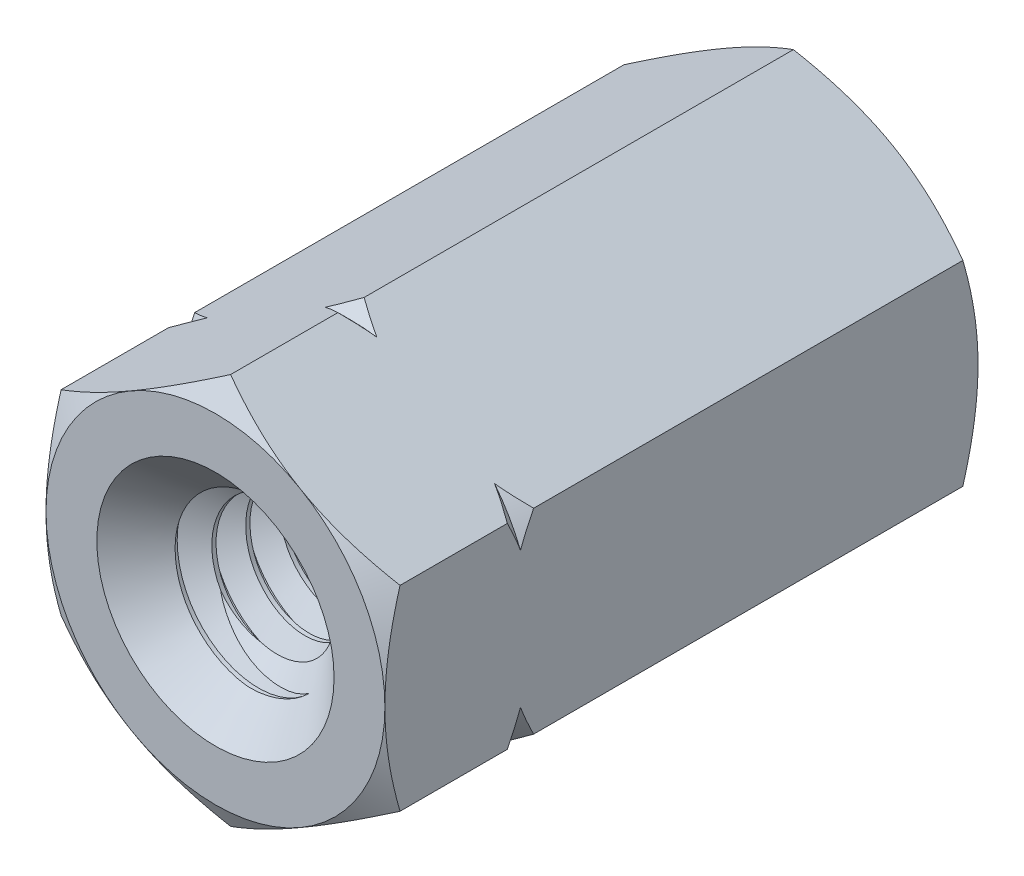
from build123d import *
from build123d.topology import SkipClean

# Parameters (mm, degrees)
BOSS_EXTRUDE1_DEPTH          = 11.1125
BOSS_EXTRUDE1_DEPTH_BACK     = 11.1125
SKETCH3_R                    = 3.175
CHAMFER1_SIZE                = 1.27
SWEEP1_PITCH                 = 1.27
SKETCH7_R                    = 4.445
CUT_EXTRUDE1_OTHER_WAY_DEPTH = 26.455202882
SKETCH8_R                    = 4.445
CUT_EXTRUDE2_OTHER_WAY_DEPTH = 25.249463144


with BuildPart() as part:
    # Sketch3 → Boss-Extrude1 (new, two sides: drawn at the far end of the back side and taken through both)
    with BuildSketch(Plane.XY.offset(-BOSS_EXTRUDE1_DEPTH_BACK)):
        Polygon((6.35, -3.666174209), (6.35, 3.666174209), (0, 7.332348419), (-6.35, 3.666174209), (-6.35, -3.666174209), (0, -7.332348419), align=None)
        Circle(SKETCH3_R, mode=Mode.SUBTRACT)
    extrude(amount=BOSS_EXTRUDE1_DEPTH + BOSS_EXTRUDE1_DEPTH_BACK)

    # Sketch4 → Cut-Revolve1 (revolve, cut)
    with BuildSketch(Plane(origin=(0, 0, 0), x_dir=(0, 0, -1), z_dir=(1, 0, 0))):
        Polygon((-11.1125, 6.35), (-10.545340876, 7.332348419), (-6.523674209, 7.332348419), (-6.0325, 6.841174209), (-5.541325791, 7.332348419), (10.545340876, 7.332348419), (11.1125, 6.35), (11.1125, 8.314696837), (-11.1125, 8.314696837), align=None)
    revolve(axis=Axis((0, 0, 11.1125), (0, 0, -1)), mode=Mode.SUBTRACT)

    # Chamfer1
    chamfer1_edges = [part.edges().sort_by_distance(p)[0] for p in [
        (-3.175, 0, 11.1125),
        (-3.175, 0, -11.1125),
    ]]
    chamfer(chamfer1_edges, length=CHAMFER1_SIZE)

    # Sweep1: the profile of Sketch6 screwed along a right-hand helix of 18.5 turns, 8 arcs to a turn; built about Z, then put on its axis
    sweep1_z = Axis((0, 0, 0), (0, 0, 1))
    sweep1_corners = [(2.350110803, 0, -0.47625), (2.350110803, 0, -0.635), (3.243740766, 0, -1.1509375), (3.243740766, 0, 0.0396875)]
    with BuildLine(mode=Mode.PRIVATE) as sweep1_profile:
        Line(sweep1_corners[0], sweep1_corners[1])
        Line(sweep1_corners[1], sweep1_corners[2])
        Line(sweep1_corners[2], sweep1_corners[3])
        Line(sweep1_corners[3], sweep1_corners[0])
    sweep1_cap = Face(sweep1_profile.wire())
    sweep1_turn_angles = [0, 22.5, 45, 67.5, 90, 112.5, 135, 157.5, 180, 202.5, 225, 247.5, 270, 292.5, 315, 337.5, 360]
    sweep1_turn_weights = [1, 0.9238795325112867, 1, 0.9238795325112867, 1, 0.9238795325112867, 1, 0.9238795325112867, 1, 0.9238795325112867, 1, 0.9238795325112867, 1, 0.9238795325112867, 1, 0.9238795325112867, 1]
    sweep1_turn_rails = [Edge.make_bspline([Vector(p[0], p[1], 0).rotate(sweep1_z, sweep1_turn_angles[k]) / sweep1_turn_weights[k] + Vector(0, 0, p[2] + SWEEP1_PITCH * sweep1_turn_angles[k] / 360) for k in range(17)], [0, 0, 0, 1, 1, 2, 2, 3, 3, 4, 4, 5, 5, 6, 6, 7, 7, 8, 8, 8], 2, sweep1_turn_weights) for p in sweep1_corners]
    sweep1_turn_sides = [Face.make_surface_from_curves(sweep1_turn_rails[p[0]], sweep1_turn_rails[p[1]]) for p in [(0, 1), (1, 2), (2, 3), (3, 0)]]
    sweep1_last_angles = [6480, 6502.5, 6525, 6547.5, 6570, 6592.5, 6615, 6637.5, 6660]
    sweep1_last_weights = [1, 0.9238795325112867, 1, 0.9238795325112867, 1, 0.9238795325112867, 1, 0.923879532511223, 1]
    sweep1_last_rails = [Edge.make_bspline([Vector(p[0], p[1], 0).rotate(sweep1_z, sweep1_last_angles[k]) / sweep1_last_weights[k] + Vector(0, 0, p[2] + SWEEP1_PITCH * sweep1_last_angles[k] / 360) for k in range(9)], [0, 0, 0, 1, 1, 2, 2, 3, 3, 4, 4, 4], 2, sweep1_last_weights) for p in sweep1_corners]
    sweep1_last_sides = [Face.make_surface_from_curves(sweep1_last_rails[p[0]], sweep1_last_rails[p[1]]) for p in [(0, 1), (1, 2), (2, 3), (3, 0)]]
    sweep1 = Plane(origin=(0, 0, 11.1125), x_dir=(0, -1, 0), z_dir=(0, 0, -1)) * Solid(Shell([*[p.moved(Location((0, 0, SWEEP1_PITCH * i))) for i in range(18) for p in sweep1_turn_sides], *sweep1_last_sides, sweep1_cap, sweep1_cap.rotate(sweep1_z, 6660).moved(Location((0, 0, SWEEP1_PITCH * 6660 / 360)))]))
    add(sweep1)

    # Cut-Extrude1 cone 1 section (through the dimple's axis) → Cut-Extrude1 (revolve, cut)
    with SkipClean():  # the faces are left unmerged after this step: merging them gives an invalid solid
        with BuildSketch(Plane(origin=(0, 0, 11.1125), x_dir=(0, -1, 0), z_dir=(1, 0, 0))):
            Polygon((0, 0), (4.445, 0), (0, 4.445), align=None)
        revolve(axis=Axis((0, 0, 11.1125), (0, 0, -1)), mode=Mode.SUBTRACT)

    # Sketch7 → Cut-Extrude1 other way (cut)
    with SkipClean():  # the faces are left unmerged after this step: merging them gives an invalid solid
        with BuildSketch(Plane.XY.offset(11.1125)):
            Circle(SKETCH7_R)
        extrude(amount=CUT_EXTRUDE1_OTHER_WAY_DEPTH, mode=Mode.SUBTRACT)

    # Cut-Extrude2 cone 1 section (through the dimple's axis) → Cut-Extrude2 (revolve, cut)
    with SkipClean():  # the faces are left unmerged after this step: merging them gives an invalid solid
        with BuildSketch(Plane(origin=(0, 0, -11.1125), x_dir=(0, 1, 0), z_dir=(1, 0, 0))):
            Polygon((0, 0), (4.445, 0), (0, 4.445), align=None)
        revolve(axis=Axis((0, 0, -11.1125), (0, 0, 1)), mode=Mode.SUBTRACT)

    # Sketch8 → Cut-Extrude2 other way (cut)
    with SkipClean():  # the faces are left unmerged after this step: merging them gives an invalid solid
        with BuildSketch(Plane(origin=(0, 0, -11.1125), x_dir=(-1, 0, 0), z_dir=(0, 0, -1))):
            Circle(SKETCH8_R)
        extrude(amount=CUT_EXTRUDE2_OTHER_WAY_DEPTH, mode=Mode.SUBTRACT)


solid = part.part
